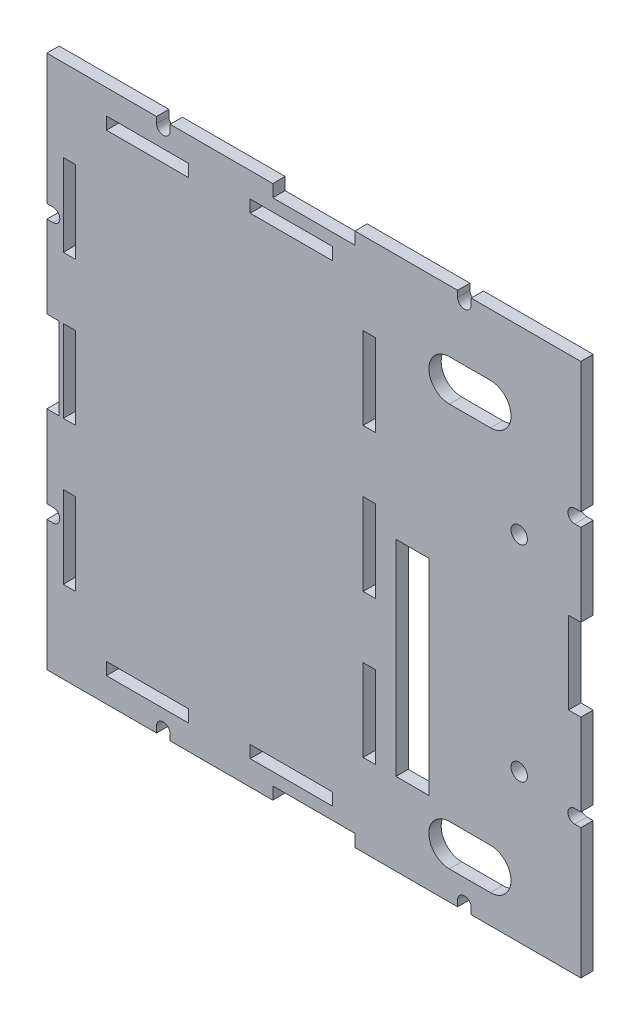
from build123d import *

# Parameters (mm, degrees)
SKETCH1_W           = 20
SKETCH1_H           = 3
SKETCH1_W_2         = 3
SKETCH1_H_2         = 20
SKETCH1_W_3         = 8
SKETCH1_H_3         = 50
SKETCH1_R           = 2
BOSS_EXTRUDE1_DEPTH = 3


with BuildPart() as part:
    # Sketch1 → Boss-Extrude1 (new body)
    with BuildSketch(Plane.XY):
        with BuildLine():
            Line((10, -62), (10, -65))
            Line((10, -65), (35, -65))
            Line((35, -65), (35, -63.5))
            ThreePointArc((35, -63.5), (36.65, -61.85), (38.3, -63.5))
            Line((38.3, -63.5), (38.3, -65))
            Line((38.3, -65), (65, -65))
            Line((65, -65), (65, -33.3))
            Line((65, -33.3), (63.5, -33.3))
            ThreePointArc((63.5, -33.3), (61.85, -31.65), (63.5, -30))
            Line((63.5, -30), (65, -30))
            Line((65, -30), (65, -10))
            Line((65, -10), (62, -10))
            Line((62, -10), (62, 10))
            Line((62, 10), (65, 10))
            Line((65, 10), (65, 30))
            Line((65, 30), (63.5, 30))
            ThreePointArc((63.5, 30), (61.85, 31.65), (63.5, 33.3))
            Line((63.5, 33.3), (65, 33.3))
            Line((65, 33.3), (65, 65))
            Line((65, 65), (38.3, 65))
            Line((38.3, 65), (38.3, 63.5))
            ThreePointArc((38.3, 63.5), (36.65, 61.85), (35, 63.5))
            Line((35, 63.5), (35, 65))
            Line((35, 65), (10, 65))
            Line((10, 65), (10, 62))
            Line((10, 62), (-10, 62))
            Line((-10, 62), (-10, 65))
            Line((-10, 65), (-35, 65))
            Line((-35, 65), (-35, 63.5))
            ThreePointArc((-35, 63.5), (-36.65, 61.85), (-38.3, 63.5))
            Line((-38.3, 63.5), (-38.3, 65))
            Line((-38.3, 65), (-65, 65))
            Line((-65, 65), (-65, 33.3))
            Line((-65, 33.3), (-63.5, 33.3))
            ThreePointArc((-63.5, 33.3), (-61.85, 31.65), (-63.5, 30))
            Line((-63.5, 30), (-65, 30))
            Line((-65, 30), (-65, 10))
            Line((-65, 10), (-62, 10))
            Line((-62, 10), (-62, -10))
            Line((-62, -10), (-65, -10))
            Line((-65, -10), (-65, -30))
            Line((-65, -30), (-63.5, -30))
            ThreePointArc((-63.5, -30), (-61.85, -31.65), (-63.5, -33.3))
            Line((-63.5, -33.3), (-65, -33.3))
            Line((-65, -33.3), (-65, -65))
            Line((-65, -65), (-38.3, -65))
            Line((-38.3, -65), (-38.3, -63.5))
            ThreePointArc((-38.3, -63.5), (-36.65, -61.85), (-35, -63.5))
            Line((-35, -63.5), (-35, -65))
            Line((-35, -65), (-10, -65))
            Line((-10, -65), (-10, -62))
            Line((-10, -62), (10, -62))
        make_face()
        with Locations((-40.5, -57.5)):
            Rectangle(SKETCH1_W, SKETCH1_H, mode=Mode.SUBTRACT)
        with Locations((-59.5, -35)):
            Rectangle(SKETCH1_W_2, SKETCH1_H_2, mode=Mode.SUBTRACT)
        with Locations((-5.5, -57.5)):
            Rectangle(SKETCH1_W, SKETCH1_H, mode=Mode.SUBTRACT)
        with Locations((13.5, -35)):
            Rectangle(SKETCH1_W_2, SKETCH1_H_2, mode=Mode.SUBTRACT)
        with BuildLine():
            Line((33, -48), (43, -48))
            ThreePointArc((43, -48), (48, -53), (43, -58))
            Line((43, -58), (33, -58))
            ThreePointArc((33, -58), (28, -53), (33, -48))
        make_face(mode=Mode.SUBTRACT)
        with Locations((24, -20)):
            Rectangle(SKETCH1_W_3, SKETCH1_H_3, mode=Mode.SUBTRACT)
        with Locations((50, -29)):
            Circle(SKETCH1_R, mode=Mode.SUBTRACT)
        with Locations((-59.5, 0)):
            Rectangle(SKETCH1_W_2, SKETCH1_H_2, mode=Mode.SUBTRACT)
        with Locations((-59.5, 35)):
            Rectangle(SKETCH1_W_2, SKETCH1_H_2, mode=Mode.SUBTRACT)
        with Locations((-40.5, 57.5)):
            Rectangle(SKETCH1_W, SKETCH1_H, mode=Mode.SUBTRACT)
        with Locations((-5.5, 57.5)):
            Rectangle(SKETCH1_W, SKETCH1_H, mode=Mode.SUBTRACT)
        with Locations((13.5, 0)):
            Rectangle(SKETCH1_W_2, SKETCH1_H_2, mode=Mode.SUBTRACT)
        with Locations((50, 21)):
            Circle(SKETCH1_R, mode=Mode.SUBTRACT)
        with Locations((13.5, 35)):
            Rectangle(SKETCH1_W_2, SKETCH1_H_2, mode=Mode.SUBTRACT)
        with BuildLine():
            ThreePointArc((43, 50), (48, 45), (43, 40))
            Line((43, 40), (33, 40))
            ThreePointArc((33, 40), (28, 45), (33, 50))
            Line((33, 50), (43, 50))
        make_face(mode=Mode.SUBTRACT)
    extrude(amount=BOSS_EXTRUDE1_DEPTH)


solid = part.part
